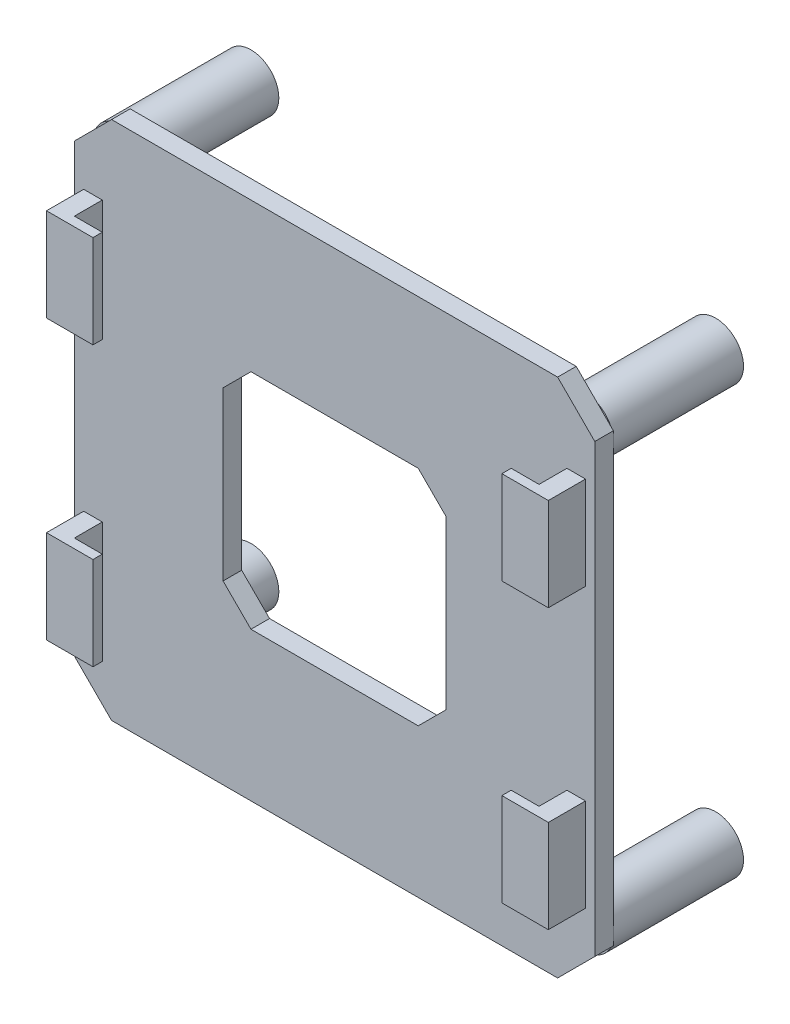
from build123d import *

# Parameters (mm, degrees)
EXTRUDE_START              = -6
EXTRUDE_275_DEPTH          = 2
EXTRUDE_START_2            = -20
SKETCH_2_R                 = 3
EXTRUDE_1_1_DEPTH          = 14
CUT_EXTRUDE_START          = -20
SKETCH_3_R                 = 1.65
CUT_EXTRUDE_M3_1_1_DEPTH   = 14
EXTRUDE_START_3            = -4
SKETCH_4_W                 = 2
SKETCH_4_H                 = 10
EXTRUDE_1_1_2_DEPTH        = 3
EXTRUDE_START_4            = -1
SKETCH_5_W                 = 5
SKETCH_5_H                 = 10
EXTRUDE_1_1_3_DEPTH        = 1
SKETCH_6_R                 = 3
EXTRUDE_1_1_4_DEPTH        = 14
SKETCH_7_R                 = 1.65
CUT_EXTRUDE_M3_1_1_2_DEPTH = 14
SKETCH_8_W                 = 2
SKETCH_8_H                 = 10
EXTRUDE_1_1_5_DEPTH        = 3
SKETCH_9_W                 = 5
SKETCH_9_H                 = 10
EXTRUDE_1_1_6_DEPTH        = 1
SKETCH_10_R                = 3
EXTRUDE_1_1_7_DEPTH        = 14
SKETCH_11_R                = 1.65
CUT_EXTRUDE_M3_1_1_3_DEPTH = 14
SKETCH_12_W                = 2
SKETCH_12_H                = 10
EXTRUDE_1_1_8_DEPTH        = 3
SKETCH_13_W                = 5
SKETCH_13_H                = 10
EXTRUDE_1_1_9_DEPTH        = 1
SKETCH_14_R                = 3
EXTRUDE_1_1_10_DEPTH       = 14
SKETCH_15_R                = 1.65
CUT_EXTRUDE_M3_1_1_4_DEPTH = 14
SKETCH_16_W                = 2
SKETCH_16_H                = 10
EXTRUDE_1_1_11_DEPTH       = 3
SKETCH_17_W                = 5
SKETCH_17_H                = 10
EXTRUDE_1_1_12_DEPTH       = 1


with BuildPart() as part:
    # 草图1 → Extrude 275 (new body)
    with BuildSketch(Plane.XY.offset(EXTRUDE_START)):
        Polygon((-24, -28), (24, -28), (28, -24), (28, 24), (24, 28), (-24, 28), (-28, 24), (-28, -24), align=None)
        Polygon((-9, -12), (9, -12), (12, -9), (12, 9), (9, 12), (-9, 12), (-12, 9), (-12, -9), align=None, mode=Mode.SUBTRACT)
    extrude(amount=EXTRUDE_275_DEPTH)

    # 草图2 → Extrude 1_-1 (add)
    with BuildSketch(Plane.XY.offset(EXTRUDE_START_2)):
        with Locations(Location((-25, -23, 0), (0, 0, 180))):
            Circle(SKETCH_2_R)
    extrude(amount=EXTRUDE_1_1_DEPTH)

    # 草图3 → Cut-Extrude M3__-1_-1 (cut)
    with BuildSketch(Plane.XY.offset(CUT_EXTRUDE_START)):
        with Locations((-25, -23)):
            Circle(SKETCH_3_R)
    extrude(amount=CUT_EXTRUDE_M3_1_1_DEPTH, mode=Mode.SUBTRACT)

    # 草图4 → Extrude 1_-1 2 (add)
    with BuildSketch(Plane.XY.offset(EXTRUDE_START_3)):
        with Locations((-26, -15)):
            Rectangle(SKETCH_4_W, SKETCH_4_H)
    extrude(amount=EXTRUDE_1_1_2_DEPTH)

    # 草图5 → Extrude 1_-1 3 (add)
    with BuildSketch(Plane.XY.offset(EXTRUDE_START_4)):
        with Locations((-24.5, -15)):
            Rectangle(SKETCH_5_W, SKETCH_5_H)
    extrude(amount=EXTRUDE_1_1_3_DEPTH)

    # 草图6 → Extrude 1_1 4 (add)
    with BuildSketch(Plane.XY.offset(EXTRUDE_START_2)):
        with Locations(Location((-25, 23, 0), (0, 0, 180))):
            Circle(SKETCH_6_R)
    extrude(amount=EXTRUDE_1_1_4_DEPTH)

    # 草图7 → Cut-Extrude M3__-1_1 2 (cut)
    with BuildSketch(Plane.XY.offset(CUT_EXTRUDE_START)):
        with Locations((-25, 23)):
            Circle(SKETCH_7_R)
    extrude(amount=CUT_EXTRUDE_M3_1_1_2_DEPTH, mode=Mode.SUBTRACT)

    # 草图8 → Extrude 1_1 5 (add)
    with BuildSketch(Plane.XY.offset(EXTRUDE_START_3)):
        with Locations((-26, 15)):
            Rectangle(SKETCH_8_W, SKETCH_8_H)
    extrude(amount=EXTRUDE_1_1_5_DEPTH)

    # 草图9 → Extrude 1_1 6 (add)
    with BuildSketch(Plane.XY.offset(EXTRUDE_START_4)):
        with Locations((-24.5, 15)):
            Rectangle(SKETCH_9_W, SKETCH_9_H)
    extrude(amount=EXTRUDE_1_1_6_DEPTH)

    # 草图10 → Extrude 1_-1 7 (add)
    with BuildSketch(Plane.XY.offset(EXTRUDE_START_2)):
        with Locations((25, -23)):
            Circle(SKETCH_10_R)
    extrude(amount=EXTRUDE_1_1_7_DEPTH)

    # 草图11 → Cut-Extrude M3__1_-1 3 (cut)
    with BuildSketch(Plane.XY.offset(CUT_EXTRUDE_START)):
        with Locations((25, -23)):
            Circle(SKETCH_11_R)
    extrude(amount=CUT_EXTRUDE_M3_1_1_3_DEPTH, mode=Mode.SUBTRACT)

    # 草图12 → Extrude 1_-1 8 (add)
    with BuildSketch(Plane.XY.offset(EXTRUDE_START_3)):
        with Locations((26, -15)):
            Rectangle(SKETCH_12_W, SKETCH_12_H)
    extrude(amount=EXTRUDE_1_1_8_DEPTH)

    # 草图13 → Extrude 1_-1 9 (add)
    with BuildSketch(Plane.XY.offset(EXTRUDE_START_4)):
        with Locations((24.5, -15)):
            Rectangle(SKETCH_13_W, SKETCH_13_H)
    extrude(amount=EXTRUDE_1_1_9_DEPTH)

    # 草图14 → Extrude 1_1 10 (add)
    with BuildSketch(Plane.XY.offset(EXTRUDE_START_2)):
        with Locations((25, 23)):
            Circle(SKETCH_14_R)
    extrude(amount=EXTRUDE_1_1_10_DEPTH)

    # 草图15 → Cut-Extrude M3__1_1 4 (cut)
    with BuildSketch(Plane.XY.offset(CUT_EXTRUDE_START)):
        with Locations((25, 23)):
            Circle(SKETCH_15_R)
    extrude(amount=CUT_EXTRUDE_M3_1_1_4_DEPTH, mode=Mode.SUBTRACT)

    # 草图16 → Extrude 1_1 11 (add)
    with BuildSketch(Plane.XY.offset(EXTRUDE_START_3)):
        with Locations((26, 15)):
            Rectangle(SKETCH_16_W, SKETCH_16_H)
    extrude(amount=EXTRUDE_1_1_11_DEPTH)

    # 草图17 → Extrude 1_1 12 (add)
    with BuildSketch(Plane.XY.offset(EXTRUDE_START_4)):
        with Locations((24.5, 15)):
            Rectangle(SKETCH_17_W, SKETCH_17_H)
    extrude(amount=EXTRUDE_1_1_12_DEPTH)


solid = part.part
